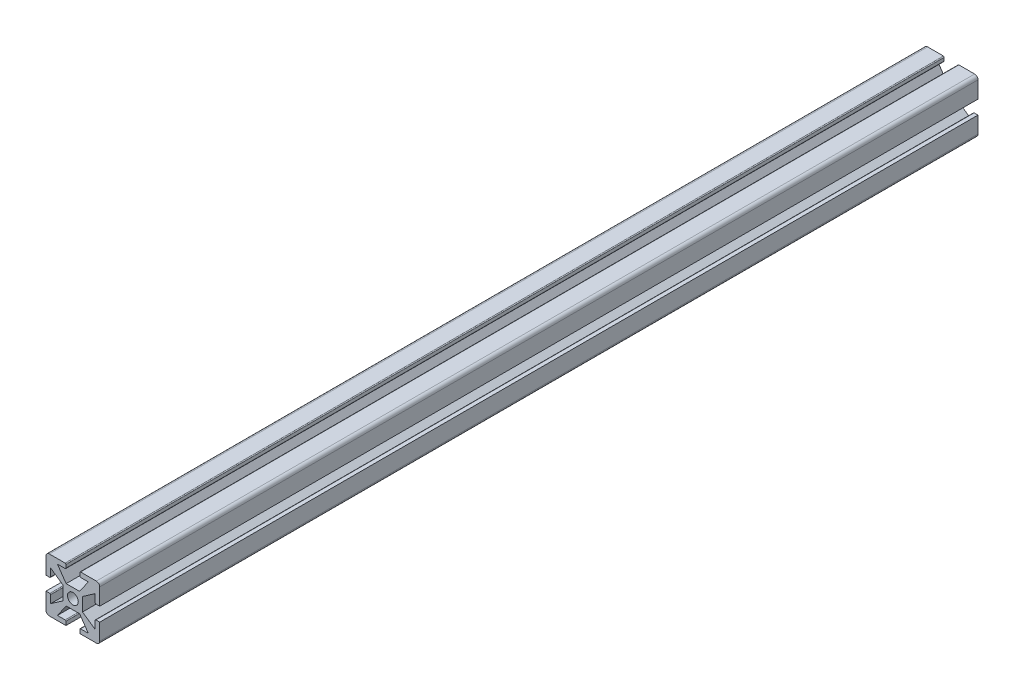
from build123d import *

# Parameters (mm, degrees)
SKETCH1_W           = 25.4
SKETCH1_H           = 25.4
BOSS_EXTRUDE1_DEPTH = 415.29
FILLET1_R           = 1.5875
HOLE1_OUTLINE_R     = 2.5527
HOLE1_DEPTH         = 415.29
SKETCH7_W           = 6.5278
SKETCH7_H           = 2.2352
CUT_EXTRUDE2_DEPTH  = 415.29
FILLET4_R           = 0.396875
CIRPATTERN2_DEPTH   = 415.29


# Read off the part's stored shape, not the designer's step: Hole1, CirPattern2
with BuildPart() as part:
    # Sketch1 → Boss-Extrude1 (new body)
    with BuildSketch(Plane.XY):
        Rectangle(SKETCH1_W, SKETCH1_H)
    extrude(amount=BOSS_EXTRUDE1_DEPTH)

    # Fillet1
    fillet1_edges = [part.edges().sort_by_distance(p)[0] for p in [
        (12.7, -12.7, 207.645),
        (-12.7, -12.7, 207.645),
        (-12.7, 12.7, 207.645),
        (12.7, 12.7, 207.645),
    ]]
    fillet(fillet1_edges, radius=FILLET1_R)

    # Hole1 outline → Hole1 (cut)
    with BuildSketch(Plane.XY):
        with Locations((0, -0.048792482)):
            Circle(HOLE1_OUTLINE_R)
    extrude(amount=HOLE1_DEPTH, mode=Mode.SUBTRACT)

    # Sketch7 → Cut-Extrude2 (cut)
    with BuildSketch(Plane.XY.offset(415.29)):
        with Locations((0, 11.5824)):
            Rectangle(SKETCH7_W, SKETCH7_H)
        Polygon((-3.175, 4.5212), (-7.3025, 10.4648), (7.3025, 10.4648), (3.175, 4.5212), align=None)
    extrude(amount=-CUT_EXTRUDE2_DEPTH, mode=Mode.SUBTRACT)

    # Fillet4
    fillet4_edges = [part.edges().sort_by_distance(p)[0] for p in [
        (-3.2639, 10.4648, 207.645),
        (-3.2639, 12.7, 207.645),
        (3.2639, 12.7, 207.645),
        (3.2639, 10.4648, 207.645),
    ]]
    fillet(fillet4_edges, radius=FILLET4_R)

    # CirPattern2 outline → CirPattern2 (cut)
    with BuildSketch(Plane.XY):
        with BuildLine():
            ThreePointArc((-3.660775, -10.562384964), (-3.380141996, -10.67862696), (-3.2639, -10.959259964))
            Line((-3.2639, -10.959259964), (-3.2639, -12.7))
            Line((-3.2639, -12.7), (3.2639, -12.7))
            Line((3.2639, -12.7), (3.2639, -10.959259964))
            ThreePointArc((3.2639, -10.959259964), (3.380141996, -10.67862696), (3.660775, -10.562384964))
            Line((3.660775, -10.562384964), (7.3025, -10.562384964))
            Line((7.3025, -10.562384964), (3.175, -4.618784964))
            Line((3.175, -4.618784964), (-3.175, -4.618784964))
            Line((-3.175, -4.618784964), (-7.3025, -10.562384964))
            Line((-7.3025, -10.562384964), (-3.660775, -10.562384964))
        make_face()
        with BuildLine():
            Line((-12.7, -3.312692482), (-10.910467482, -3.312692482))
            ThreePointArc((-10.910467482, -3.312692482), (-10.629834478, -3.428934478), (-10.513592482, -3.709567482))
            Line((-10.513592482, -3.709567482), (-10.513592482, -7.351292482))
            Line((-10.513592482, -7.351292482), (-4.569992482, -3.223792482))
            Line((-4.569992482, -3.223792482), (-4.569992482, 3.126207518))
            Line((-4.569992482, 3.126207518), (-10.513592482, 7.253707518))
            Line((-10.513592482, 7.253707518), (-10.513592482, 3.611982518))
            ThreePointArc((-10.513592482, 3.611982518), (-10.629834478, 3.331349514), (-10.910467482, 3.215107518))
            Line((-10.910467482, 3.215107518), (-12.7, 3.215107518))
            Line((-12.7, 3.215107518), (-12.7, -3.312692482))
        make_face()
        with BuildLine():
            ThreePointArc((10.513592482, -3.709567482), (10.629834478, -3.428934478), (10.910467482, -3.312692482))
            Line((10.910467482, -3.312692482), (12.7, -3.312692482))
            Line((12.7, -3.312692482), (12.7, 3.215107518))
            Line((12.7, 3.215107518), (10.910467482, 3.215107518))
            ThreePointArc((10.910467482, 3.215107518), (10.629834478, 3.331349514), (10.513592482, 3.611982518))
            Line((10.513592482, 3.611982518), (10.513592482, 7.253707518))
            Line((10.513592482, 7.253707518), (4.569992482, 3.126207518))
            Line((4.569992482, 3.126207518), (4.569992482, -3.223792482))
            Line((4.569992482, -3.223792482), (10.513592482, -7.351292482))
            Line((10.513592482, -7.351292482), (10.513592482, -3.709567482))
        make_face()
    extrude(amount=CIRPATTERN2_DEPTH, mode=Mode.SUBTRACT)


solid = part.part
